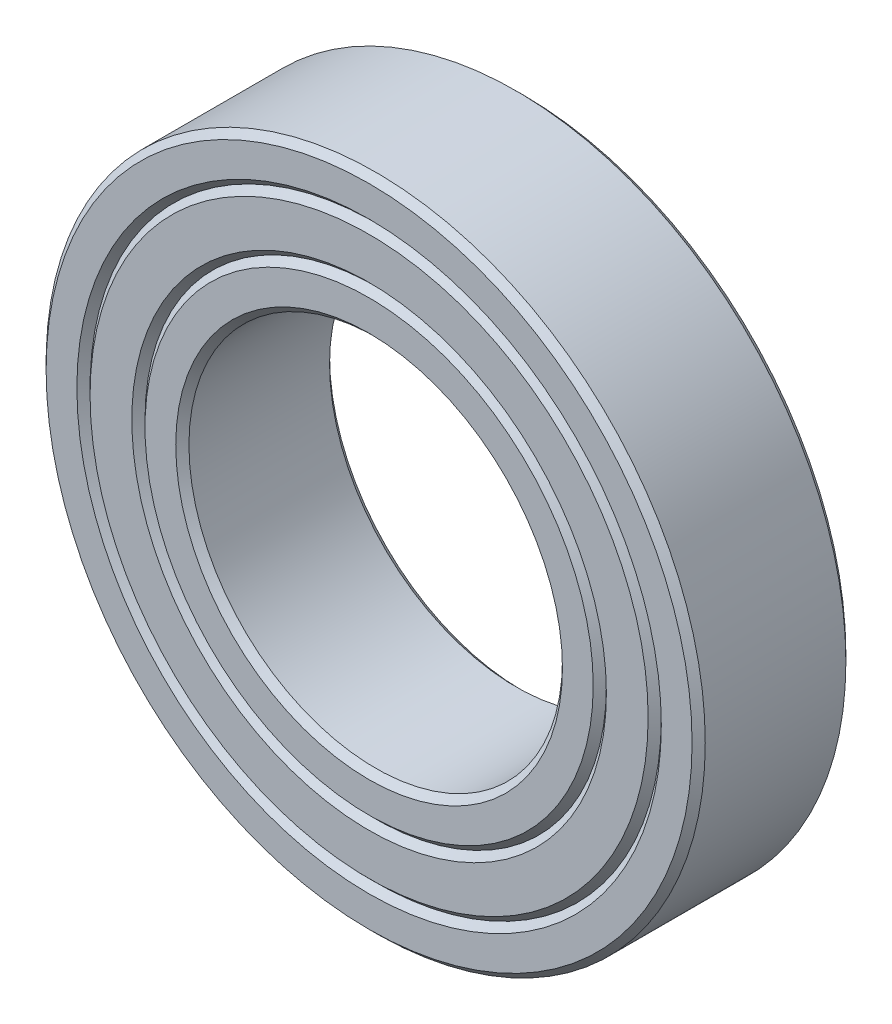
from build123d import *

# Parameters (mm, degrees)
SKETCH1_R            = 15
SKETCH1_R_2          = 8.5
EXTRUDE1_DEPTH       = 3.5
SPLIT1_START         = -3.5
SPLIT1_OUTLINE_R     = 10.5
SPLIT1_OUTLINE_R_2   = 8.5
SPLIT1_DEPTH         = 7
SPLIT1_2_OUTLINE_R   = 13
SPLIT1_2_OUTLINE_R_2 = 10.5
SPLIT1_2_DEPTH       = 7
SPLIT1_3_OUTLINE_R   = 13
SPLIT1_3_OUTLINE_R_2 = 8.5
SPLIT1_3_DEPTH       = 7
CHAMFER1_SIZE        = 0.3
CHAMFER2_SIZE        = 0.3
CHAMFER3_SIZE        = 0.3


# Read off the part's stored shape, not the designer's step: Split1
with BuildPart() as part:
    # Sketch1 → Extrude1 (new, symmetric)
    with BuildSketch(Plane.XY):
        Circle(SKETCH1_R)
        Circle(SKETCH1_R_2, mode=Mode.SUBTRACT)
    extrude(amount=EXTRUDE1_DEPTH, both=True)

    # Split1 3 outline → Split1 3 (cut)
    with BuildSketch(Plane.XY.offset(SPLIT1_START)):
        Circle(SPLIT1_3_OUTLINE_R)
        Circle(SPLIT1_3_OUTLINE_R_2, mode=Mode.SUBTRACT)
    extrude(amount=SPLIT1_3_DEPTH, mode=Mode.SUBTRACT)

    # Chamfer1
    chamfer1_edges = [part.edges().sort_by_distance(p)[0] for p in [
        (-13, 0, -3.5),
        (-15, 0, -3.5),
        (-13, 0, 3.5),
        (-15, 0, 3.5),
    ]]
    chamfer(chamfer1_edges, length=CHAMFER1_SIZE)


with BuildPart() as body_2:
    # Split1 outline → Split1 (new body)
    with BuildSketch(Plane.XY.offset(SPLIT1_START)):
        Circle(SPLIT1_OUTLINE_R)
        Circle(SPLIT1_OUTLINE_R_2, mode=Mode.SUBTRACT)
    extrude(amount=SPLIT1_DEPTH)

    # Chamfer3
    chamfer3_edges = [body_2.edges().sort_by_distance(p)[0] for p in [
        (-8.5, 0, -3.5),
        (-8.5, 0, 3.5),
        (-10.5, 0, 3.5),
        (-10.5, 0, -3.5),
    ]]
    chamfer(chamfer3_edges, length=CHAMFER3_SIZE)


with BuildPart() as body_3:
    # Split1 2 outline → Split1 2 (new body)
    with BuildSketch(Plane.XY.offset(SPLIT1_START)):
        Circle(SPLIT1_2_OUTLINE_R)
        Circle(SPLIT1_2_OUTLINE_R_2, mode=Mode.SUBTRACT)
    extrude(amount=SPLIT1_2_DEPTH)

    # Chamfer2
    chamfer2_edges = [body_3.edges().sort_by_distance(p)[0] for p in [
        (-10.5, 0, -3.5),
        (-13, 0, 3.5),
        (-10.5, 0, 3.5),
        (-13, 0, -3.5),
    ]]
    chamfer(chamfer2_edges, length=CHAMFER2_SIZE)


solid = Compound([part.part, body_2.part, body_3.part])
